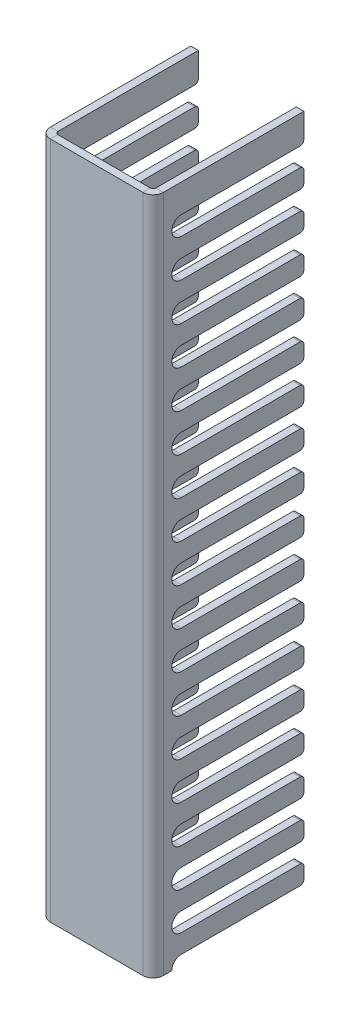
from build123d import *

# Parameters (mm, degrees)
SKETCH_1_W                         = 30
SKETCH_1_H                         = 180
SM_BASE_FLANGE_1_DEPTH             = 2
SM_EDGE_FLANGE_1_STRIP_W           = 9.4732
SM_EDGE_FLANGE_1_STRIP_H           = 2
SM_EDGE_FLANGE_1_STRIP_CUT_DEPTH   = 180
SM_EDGE_FLANGE_1_STRIP_2_W         = 9.4732
SM_EDGE_FLANGE_1_STRIP_2_H         = 2
SM_EDGE_FLANGE_1_STRIP_CUT_2_DEPTH = 180
SM_EDGE_FLANGE_1_DEPTH             = 180
SM_EDGE_FLANGE_1_BEND_DEPTH        = 180
CUT_EXTRUDE_1_DEPTH                = 30
PATTERN_LINEAR_1_COUNT             = 19
PATTERN_LINEAR_1_PITCH             = 10


# Sheet-metal steps are written as plain solids
with BuildPart() as part:
    # Sketch 1 → 基体-法兰1 (new body)
    with BuildSketch(Plane.XY):
        with Locations((-3.013245033, -54.311258278)):
            Rectangle(SKETCH_1_W, SKETCH_1_H)
    extrude(amount=-SM_BASE_FLANGE_1_DEPTH)

    # 边线-法兰1 strip (across the edge) → 边线-法兰1 strip cut (cut)
    with BuildSketch(Plane(origin=(11.986754967, 35.688741722, -2), x_dir=(-1, 0, 0), z_dir=(0, -1, 0))):
        with Locations((-2, -1)):
            Rectangle(SM_EDGE_FLANGE_1_STRIP_W, SM_EDGE_FLANGE_1_STRIP_H)
    extrude(amount=SM_EDGE_FLANGE_1_STRIP_CUT_DEPTH, mode=Mode.SUBTRACT)

    # 边线-法兰1 strip 2 (across the edge) → 边线-法兰1 strip cut 2 (cut)
    with BuildSketch(Plane(origin=(-18.013245033, -144.311258278, -2), x_dir=(1, 0, 0), z_dir=(0, 1, 0))):
        with Locations((-2, -1)):
            Rectangle(SM_EDGE_FLANGE_1_STRIP_2_W, SM_EDGE_FLANGE_1_STRIP_2_H)
    extrude(amount=SM_EDGE_FLANGE_1_STRIP_CUT_2_DEPTH, mode=Mode.SUBTRACT)

    # 边线-法兰1 section (across the edge) → 边线-法兰1 (add)
    with BuildSketch(Plane(origin=(11.986754967, 35.688741722, -2), x_dir=(-1, 0, 0), z_dir=(0, -1, 0))):
        with BuildLine():
            Line((0, 0.7366), (0, 38))
            Line((0, 38), (2, 38))
            Line((2, 38), (2, 0.7366))
            ThreePointArc((2, 0.7366), (2.215745145, 0.215745145), (2.7366, 0))
            Line((2.7366, 0), (2.7366, -2))
            ThreePointArc((2.7366, -2), (0.801531583, -1.198468417), (0, 0.7366))
        make_face()
    extrude(amount=SM_EDGE_FLANGE_1_DEPTH)

    # 边线-法兰1 section 2 (across the edge) → 边线-法兰1 bend (add)
    with BuildSketch(Plane(origin=(-18.013245033, -144.311258278, -2), x_dir=(1, 0, 0), z_dir=(0, 1, 0))):
        with BuildLine():
            Line((0, 0.7366), (0, 38))
            Line((0, 38), (2, 38))
            Line((2, 38), (2, 0.7366))
            ThreePointArc((2, 0.7366), (2.215745145, 0.215745145), (2.7366, 0))
            Line((2.7366, 0), (2.7366, -2))
            ThreePointArc((2.7366, -2), (0.801531583, -1.198468417), (0, 0.7366))
        make_face()
    extrude(amount=SM_EDGE_FLANGE_1_BEND_DEPTH)

    # 草图11 → 切除-拉伸1 (cut)
    with BuildSketch(Plane.ZY.offset(18.013245033)):
        with BuildLine():
            Line((-7.450035612, 28.188741722), (-39, 28.188741722))
            ThreePointArc((-39, 28.188741722), (-39.707106781, 28.481634941), (-40, 29.188741722))
            Line((-40, 29.188741722), (-40, 22.188741722))
            ThreePointArc((-40, 22.188741722), (-39.707106781, 22.895848503), (-39, 23.188741722))
            Line((-39, 23.188741722), (-7.450035612, 23.188741722))
            ThreePointArc((-7.450035612, 23.188741722), (-4.950035612, 25.688741722), (-7.450035612, 28.188741722))
        make_face()
    cut_extrude_1 = extrude(amount=-CUT_EXTRUDE_1_DEPTH, mode=Mode.SUBTRACT)

    # 阵列(线性)1: 切除-拉伸1 ×19
    with Locations(*[(0, -i * PATTERN_LINEAR_1_PITCH, 0) for i in range(1, PATTERN_LINEAR_1_COUNT)]):
        add(cut_extrude_1, mode=Mode.SUBTRACT)


solid = part.part
